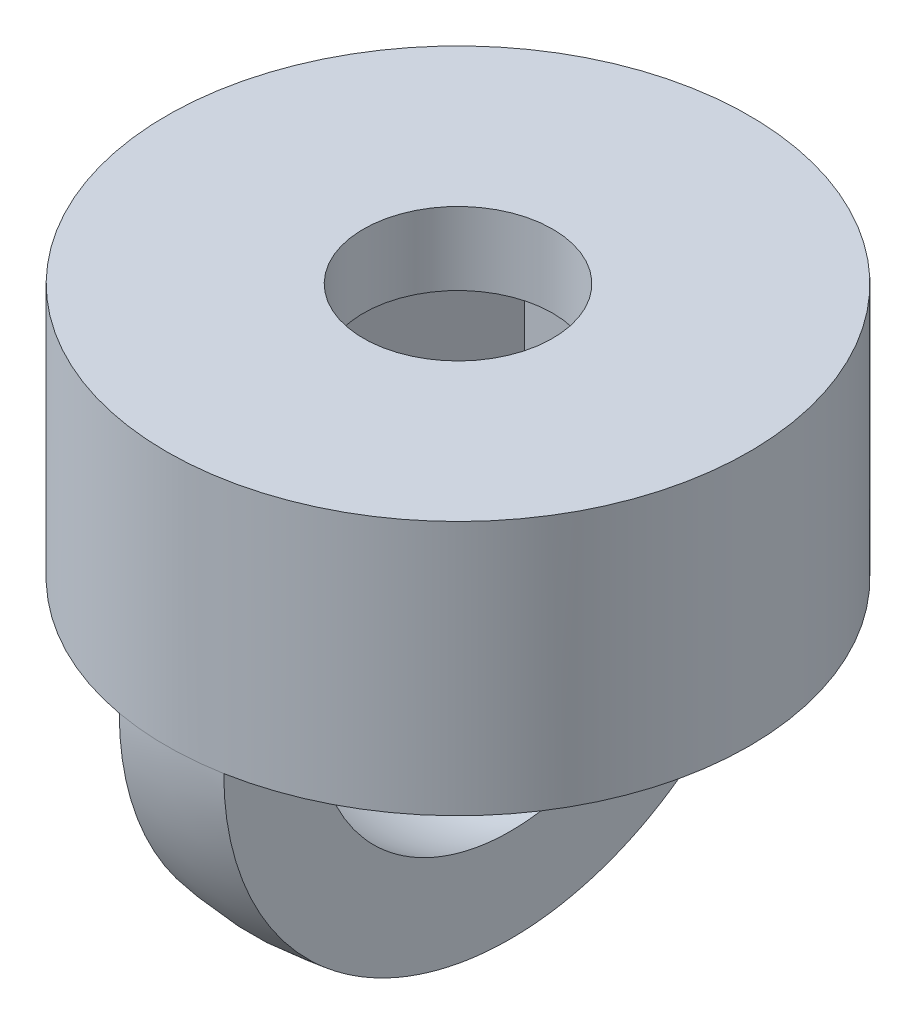
from build123d import *

# Parameters (mm, degrees)
SKETCH1_R           = 8
BOSS_EXTRUDE1_DEPTH = 5
SKETCH2_R           = 8
BOSS_EXTRUDE2_DEPTH = 2
SKETCH3_R           = 2.6
CUT_EXTRUDE1_DEPTH  = 2
SKETCH6_W           = 7.287885745
SKETCH6_H           = 18.210888192
SKETCH6_W_2         = 7.49722984
CUT_EXTRUDE2_DEPTH  = 8


with BuildPart() as part:
    # Sketch1 → Boss-Extrude1 (new body)
    with BuildSketch(Plane(origin=(0, 0, 0), x_dir=(1, 0, 0), z_dir=(0, 1, 0))):
        Circle(SKETCH1_R)
        Polygon((-2.5, 4.330127019), (2.5, 4.330127019), (5, 0), (2.5, -4.330127019), (-2.5, -4.330127019), (-5, 0), align=None, mode=Mode.SUBTRACT)
    extrude(amount=BOSS_EXTRUDE1_DEPTH)

    # Sketch2 → Boss-Extrude2 (add)
    with BuildSketch(Plane(origin=(0, 5, 0), x_dir=(1, 0, 0), z_dir=(0, 1, 0))):
        Circle(SKETCH2_R)
    extrude(amount=BOSS_EXTRUDE2_DEPTH)

    # Sketch3 → Cut-Extrude1 (cut)
    with BuildSketch(Plane.XZ.offset(-5)):
        Circle(SKETCH3_R)
    extrude(amount=-CUT_EXTRUDE1_DEPTH, mode=Mode.SUBTRACT)

    # Sketch5 → Revolve1 (revolve)
    with BuildSketch(Plane.XY):
        with BuildLine():
            Line((-8, 0), (-5.5, 0))
            ThreePointArc((-5.5, 0), (-3.889087297, -3.889087297), (0, -5.5))
            Line((0, -5.5), (0, -8))
            ThreePointArc((0, -8), (-5.656854249, -5.656854249), (-8, 0))
        make_face()
    revolve(axis=Axis((0, 5, 0), (0, -1, 0)))

    # Sketch6 → Cut-Extrude2 (cut)
    with BuildSketch(Plane(origin=(0, 0, 0), x_dir=(-1, 0, 0), z_dir=(0, -1, 0))):
        with Locations((5.079146944, 0)):
            Rectangle(SKETCH6_W, SKETCH6_H)
        with Locations((-5.183818992, 0)):
            Rectangle(SKETCH6_W_2, SKETCH6_H)
    extrude(amount=CUT_EXTRUDE2_DEPTH, mode=Mode.SUBTRACT)


solid = part.part
